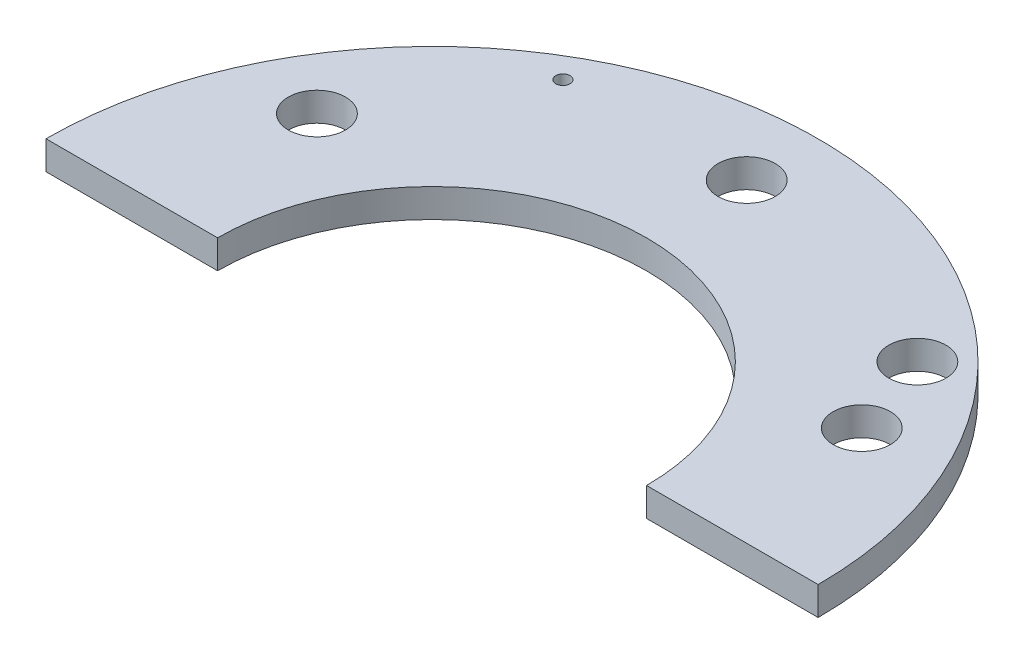
from build123d import *

# Parameters (mm, degrees)
SKETCH1_R               = 13.5
BOSS_EXTRUDE1_DEPTH     = 1
CUT_EXTRUDE1_DEPTH      = 20.118054294
CUT_EXTRUDE1_DEPTH_BACK = 20.118054294
SKETCH19_R              = 1
CUT_EXTRUDE2_DEPTH      = 20.118054294
CUT_EXTRUDE2_DEPTH_BACK = 20.118054294
SKETCH20_R              = 7.5
SKETCH21_W              = 65.874202484
SKETCH21_H              = 51.979273979
CUT_EXTRUDE3_DEPTH      = 20.118054294
CUT_EXTRUDE4_DEPTH      = 20.118054294
CUT_EXTRUDE4_DEPTH_BACK = 20.118054294
SKETCH22_R              = 0.25
CUT_EXTRUDE5_DEPTH      = 20.118054294
CUT_EXTRUDE5_DEPTH_BACK = 20.118054294
SKETCH23_R              = 1


with BuildPart() as part:
    # Sketch1 → Boss-Extrude1 (new body)
    with BuildSketch(Plane(origin=(0, 0, 0), x_dir=(1, 0, 0), z_dir=(0, 1, 0))):
        Circle(SKETCH1_R)
    extrude(amount=BOSS_EXTRUDE1_DEPTH)

    # Sketch19 → Cut-Extrude1 (cut, two sides: drawn at the far end of the back side and taken through both)
    with BuildSketch(Plane(origin=(0, 1, 0), x_dir=(1, 0, 0), z_dir=(0, 1, 0)).offset(-CUT_EXTRUDE1_DEPTH_BACK)):
        with Locations((0, 11)):
            Circle(SKETCH19_R)
        with Locations((9.526279442, 5.5)):
            Circle(SKETCH19_R)
        with Locations((9.526279442, -5.5)):
            Circle(SKETCH19_R)
        with Locations((0, -11)):
            Circle(SKETCH19_R)
        with Locations((-9.526279442, -5.5)):
            Circle(SKETCH19_R)
        with Locations((-9.526279442, 5.5)):
            Circle(SKETCH19_R)
    extrude(amount=CUT_EXTRUDE1_DEPTH + CUT_EXTRUDE1_DEPTH_BACK, mode=Mode.SUBTRACT)

    # Sketch20 → Cut-Extrude2 (cut, two sides: drawn at the far end of the back side and taken through both)
    with BuildSketch(Plane(origin=(0, 1, 0), x_dir=(1, 0, 0), z_dir=(0, 1, 0)).offset(-CUT_EXTRUDE2_DEPTH_BACK)):
        Circle(SKETCH20_R)
    extrude(amount=CUT_EXTRUDE2_DEPTH + CUT_EXTRUDE2_DEPTH_BACK, mode=Mode.SUBTRACT)

    # Sketch21 → Cut-Extrude3 (cut, through all)
    with BuildSketch(Plane.XY):
        with Locations((-3.816154381, 6.321647006)):
            Rectangle(SKETCH21_W, SKETCH21_H)
    extrude(amount=CUT_EXTRUDE3_DEPTH, mode=Mode.SUBTRACT)

    # Sketch22 → Cut-Extrude4 (cut, two sides: drawn at the far end of the back side and taken through both)
    with BuildSketch(Plane(origin=(0, 1, 0), x_dir=(1, 0, 0), z_dir=(0, 1, 0)).offset(-CUT_EXTRUDE4_DEPTH_BACK)):
        with Locations((-6.25, 10.825317547)):
            Circle(SKETCH22_R)
    extrude(amount=CUT_EXTRUDE4_DEPTH + CUT_EXTRUDE4_DEPTH_BACK, mode=Mode.SUBTRACT)

    # Sketch23 → Cut-Extrude5 (cut, two sides: drawn at the far end of the back side and taken through both)
    with BuildSketch(Plane(origin=(0, 1, 0), x_dir=(1, 0, 0), z_dir=(0, 1, 0)).offset(-CUT_EXTRUDE5_DEPTH_BACK)):
        with Locations((8.485281374, 8.485281374)):
            Circle(SKETCH23_R)
    extrude(amount=CUT_EXTRUDE5_DEPTH + CUT_EXTRUDE5_DEPTH_BACK, mode=Mode.SUBTRACT)


solid = part.part
